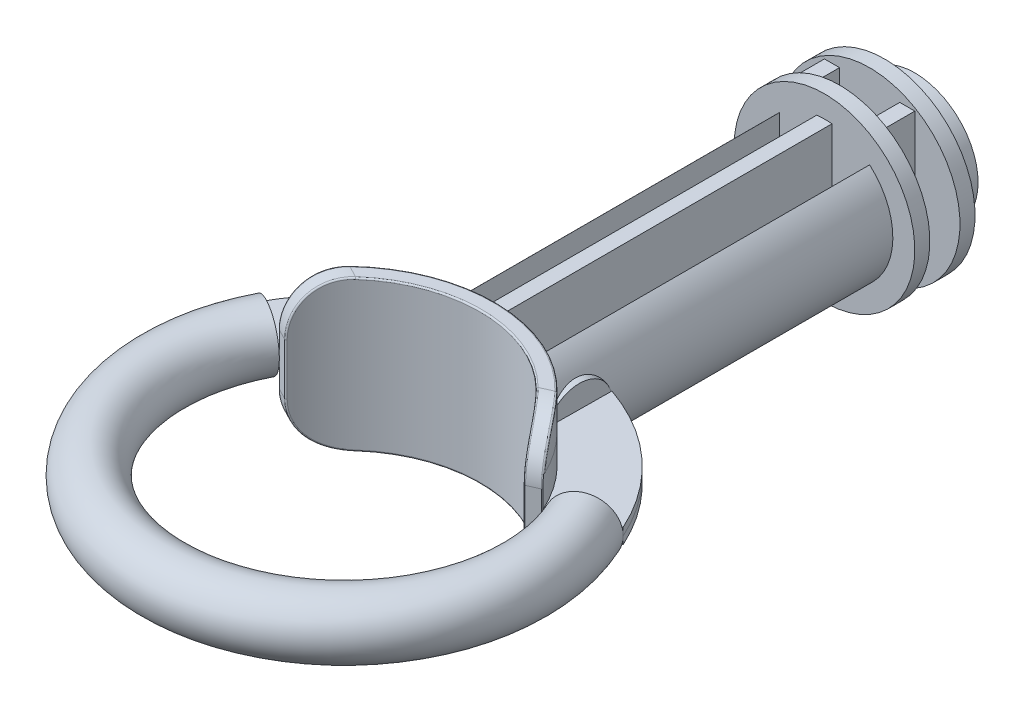
from build123d import *

# Parameters (mm, degrees)
SKETCH2_R                 = 2
BOSS_EXTRUDE1_DEPTH       = 0.88
BOSS_EXTRUDE1_DEPTH_BACK  = 22
SKETCH3_R                 = 4.542662117
BOSS_EXTRUDE10_DEPTH      = 5
BOSS_EXTRUDE10_DEPTH_BACK = 5
SKETCH7_R                 = 6
BOSS_EXTRUDE11_DEPTH      = 1
FILLET1_R                 = 3.3
FILLET2_R                 = 0.1
SKETCH9_W                 = 1.00119522
SKETCH9_H                 = 10
BOSS_EXTRUDE12_DEPTH      = 2
SKETCH10_W                = 3.99880478
SKETCH10_H                = 3.999590764
BOSS_EXTRUDE13_DEPTH      = 2
SKETCH11_R                = 6
BOSS_EXTRUDE14_DEPTH      = 1
BOSS_EXTRUDE15_DEPTH      = 1
SKETCH13_R                = 4.2
BOSS_EXTRUDE16_DEPTH      = 1
BOSS_EXTRUDE17_DEPTH      = 1
FILLET3_R                 = 7
SKETCH15_W                = 2.491765232
SKETCH15_H                = 22
SKETCH15_W_2              = 2.505572175
CUT_EXTRUDE2_DEPTH        = 4
SKETCH16_W                = 2.5
SKETCH16_H                = 22
SKETCH16_W_2              = 2.444127914
CUT_EXTRUDE3_DEPTH        = 4
CUT_EXTRUDE4_DEPTH        = 2
BOSS_EXTRUDE20_DEPTH      = 0.5
CUT_EXTRUDE5_DEPTH        = 2.5
BOSS_EXTRUDE22_DEPTH      = 0.5
CUT_EXTRUDE6_DEPTH        = 2.5
BOSS_EXTRUDE23_DEPTH      = 0.5
CUT_EXTRUDE8_START        = 2.5
CUT_EXTRUDE8_DEPTH        = 2.5
BOSS_EXTRUDE24_DEPTH      = 0.5


with BuildPart() as part:
    # Sketch2 → Revolve1 (revolve)
    with BuildSketch(Plane.XY, mode=Mode.PRIVATE) as revolve1_sk:
        with Locations((12, 0)):
            Circle(SKETCH2_R)
    revolve(revolve1_sk.sketch.rotate(Axis((0, 55, 0), (0, -1, 0)), 90), axis=Axis((0, 55, 0), (0, -1, 0)))

    # Sketch3 → Boss-Extrude1 (add, two sides: drawn at the far end of the back side and taken through both)
    with BuildSketch(Plane.XY.offset(-9.9).offset(-BOSS_EXTRUDE1_DEPTH_BACK)):
        with Locations(Location((0, 0, 0), (0, 0, 172.781900903))):
            Circle(SKETCH3_R)
    extrude(amount=BOSS_EXTRUDE1_DEPTH + BOSS_EXTRUDE1_DEPTH_BACK)

    # Sketch7 → Boss-Extrude11 (add)
    with BuildSketch(Plane(origin=(0, 0, -31.9), x_dir=(-1, 0, 0), z_dir=(0, 0, -1))):
        Circle(SKETCH7_R)
    extrude(amount=BOSS_EXTRUDE11_DEPTH)

    # Sketch9 → Boss-Extrude12 (add)
    with BuildSketch(Plane(origin=(0, 0, -32.9), x_dir=(-1, 0, 0), z_dir=(0, 0, -1))):
        with Locations((-2.5, 0)):
            Rectangle(SKETCH9_W, SKETCH9_H)
    boss_extrude12 = extrude(amount=BOSS_EXTRUDE12_DEPTH)

    # Mirror1: Boss-Extrude12 across plane
    add(boss_extrude12.mirror(Plane(origin=(0, 0, 0), x_dir=(0, 0, 1), z_dir=(1, 0, 0))))

    # Sketch10 → Boss-Extrude13 (add)
    with BuildSketch(Plane(origin=(0, 0, -32.9), x_dir=(-1, 0, 0), z_dir=(0, 0, -1))):
        Rectangle(SKETCH10_W, SKETCH10_H)
    extrude(amount=BOSS_EXTRUDE13_DEPTH)

    # Sketch11 → Boss-Extrude14 (add)
    with BuildSketch(Plane(origin=(0, 0, -34.9), x_dir=(-1, 0, 0), z_dir=(0, 0, -1))):
        Circle(SKETCH11_R)
    extrude(amount=BOSS_EXTRUDE14_DEPTH)

    # Sketch12 → Boss-Extrude15 (add)
    with BuildSketch(Plane(origin=(0, 0, -35.9), x_dir=(-1, 0, 0), z_dir=(0, 0, -1))):
        Polygon((-0.5, 0.5), (-0.5, 3), (0.5, 3), (0.5, 0.5), (3, 0.5), (3, -0.5), (0.5, -0.5), (0.5, -3), (-0.5, -3), (-0.5, -0.5), (-3, -0.5), (-3, 0.5), align=None)
    extrude(amount=BOSS_EXTRUDE15_DEPTH)

    # Sketch13 → Boss-Extrude16 (add)
    with BuildSketch(Plane(origin=(0, 0, -36.9), x_dir=(-1, 0, 0), z_dir=(0, 0, -1))):
        Circle(SKETCH13_R)
    extrude(amount=BOSS_EXTRUDE16_DEPTH)

    # Sketch14 → Boss-Extrude17 (add)
    with BuildSketch(Plane(origin=(0, 0, -37.9), x_dir=(-1, 0, 0), z_dir=(0, 0, -1))):
        Polygon((0.5, -4.170131892), (-0.5, -4.170131892), (-0.5, -0.5), (-4.170131892, -0.5), (-4.170131892, 0.5), (-0.5, 0.5), (-0.5, 4.170131892), (0.5, 4.170131892), (0.5, 0.5), (4.170131892, 0.5), (4.170131892, -0.5), (0.5, -0.5), align=None)
    extrude(amount=BOSS_EXTRUDE17_DEPTH)

    # Fillet3
    # the kernel refuses this fillet: 7 mm, written as the material it takes off along each edge
    with BuildSketch(Plane(origin=(-9.513878189, -4.170131892, -38.9), x_dir=(0, 0, 1), z_dir=(1, 0, 0)), Plane(origin=(4.170131892, -9.513878189, -38.9), x_dir=(0, 0, 1), z_dir=(0, 1, 0)), Plane(origin=(9.513878189, 4.170131892, -38.9), x_dir=(0, 0, 1), z_dir=(-1, 0, 0)), Plane(origin=(-4.170131892, 9.513878189, -38.9), x_dir=(0, 0, 1), z_dir=(0, -1, 0))) as fillet3_piece_1:
        with BuildLine():
            CenterArc((7, -3.605551275), FILLET3_R, 148.997280866, 31.002719134)
            Line((0, -3.605551275), (-0.14, -3.605551275))
            Line((-0.14, -3.605551275), (-0.14, 0))
            Line((-0.14, 0), (0, 0.14))
            ThreePointArc((0, 0.14), (0.5, 0.14), (0.88, 0.072111026))
            Line((0.88, 0.072111026), (1, 0))
        make_face()
    extrude(amount=19.027756377, mode=Mode.SUBTRACT)


with BuildPart() as body_2:
    # Sketch6 → Boss-Extrude10 (new, two sides: drawn at the far end of the back side and taken through both)
    with BuildSketch(Plane(origin=(0, 0, 0), x_dir=(1, 0, 0), z_dir=(0, 1, 0)).offset(-BOSS_EXTRUDE10_DEPTH_BACK)):
        with BuildLine():
            Line((-8.901001444, 4.557649975), (-8.022493262, 4.107820502))
            ThreePointArc((-8.022493262, 4.107820502), (0.224940881, 9.010215814), (8.217475852, 3.702388154))
            Line((8.217475852, 3.702388154), (9.117335725, 4.107820502))
            ThreePointArc((9.117335725, 4.107820502), (0.249573174, 9.996885176), (-8.901001444, 4.557649975))
        make_face()
    extrude(amount=BOSS_EXTRUDE10_DEPTH + BOSS_EXTRUDE10_DEPTH_BACK)

    # Fillet1
    fillet1_edges = [body_2.edges().sort_by_distance(p)[0] for p in [
        (-8.461747353, 5, -4.332735239),
        (8.667405789, 5, -3.905104328),
        (8.667405789, -5, -3.905104328),
        (-8.461747353, -5, -4.332735239),
    ]]
    fillet(fillet1_edges, radius=FILLET1_R)

    # Fillet2
    fillet2_edges = [body_2.edges().sort_by_distance(p)[0] for p in [
        (0.249573174, 5, -9.996885176),
        (0.224940881, 5, -9.010215814),
        (-8.901001444, 0, -4.557649975),
        (9.117335725, 0, -4.107820502),
        (0.249573174, -5, -9.996885176),
        (8.667354831, -4.053768605, -4.987680847),
        (-8.407676864, -4.053768594, -5.413960614),
        (-8.407676864, 4.053768594, -5.413960614),
        (8.667354817, 4.053768594, -4.987680851),
        (8.217475852, 0, -3.702388154),
        (-8.022493262, 0, -4.107820502),
        (0.224940881, -5, -9.010215814),
        (7.75998967, -4.05875642, -4.584446258),
        (-7.521563076, -4.058756449, -4.965951678),
        (-7.521563076, 4.058756449, -4.965951678),
        (7.75998967, 4.05875642, -4.584446258),
    ]]
    fillet(fillet2_edges, radius=FILLET2_R)


with BuildPart() as cut_extrude2_tool:
    # Sketch15 → Cut-Extrude2 (new body)
    with BuildSketch(Plane(origin=(0, 4.6, 0), x_dir=(1, 0, 0), z_dir=(0, 1, 0))):
        with Locations((-1.754117384, 20.9)):
            Rectangle(SKETCH15_W, SKETCH15_H)
        with Locations((1.747213912, 20.9)):
            Rectangle(SKETCH15_W_2, SKETCH15_H)
    extrude(amount=-CUT_EXTRUDE2_DEPTH)


with BuildPart() as part_1:
    add(part.part)

    # Cut-Extrude2: cut by cut_extrude2_tool
    add(cut_extrude2_tool.part, mode=Mode.SUBTRACT)


with BuildPart() as body_2_1:
    add(body_2.part)

    # Cut-Extrude2: cut by cut_extrude2_tool
    add(cut_extrude2_tool.part, mode=Mode.SUBTRACT)


with BuildPart() as cut_extrude3_tool:
    # Sketch16 → Cut-Extrude3 (new body)
    with BuildSketch(Plane(origin=(0, -4.5, 0), x_dir=(1, 0, 0), z_dir=(0, 1, 0))):
        with Locations((1.707075343, 20.897464392)):
            Rectangle(SKETCH16_W, SKETCH16_H)
        with Locations((-1.8208607, 20.897464392)):
            Rectangle(SKETCH16_W_2, SKETCH16_H)
    extrude(amount=CUT_EXTRUDE3_DEPTH)


with BuildPart() as part_2:
    add(part_1.part)

    # Cut-Extrude3: cut by cut_extrude3_tool
    add(cut_extrude3_tool.part, mode=Mode.SUBTRACT)


with BuildPart() as body_2_2:
    add(body_2_1.part)

    # Cut-Extrude3: cut by cut_extrude3_tool
    add(cut_extrude3_tool.part, mode=Mode.SUBTRACT)


with BuildPart() as cut_extrude4_tool:
    # Sketch17 → Cut-Extrude4 (new body)
    with BuildSketch(Plane(origin=(0, 0, 0), x_dir=(1, 0, 0), z_dir=(0, 1, 0))):
        with BuildLine():
            Line((-8.860703893, 4.568842081), (-12.443220527, 6.416094055))
            ThreePointArc((-12.443220527, 6.416094055), (-9.164357143, 10.58369303), (-4.570697172, 13.232865425))
            Line((-4.570697172, 13.232865425), (-4.570697172, 8.876653422))
            ThreePointArc((-4.570697172, 8.876653422), (-7.066682392, 7.072278968), (-8.860703893, 4.568842081))
        make_face()
    extrude(amount=-CUT_EXTRUDE4_DEPTH)


with BuildPart() as part_3:
    add(part_2.part)

    # Cut-Extrude4: cut by cut_extrude4_tool
    add(cut_extrude4_tool.part, mode=Mode.SUBTRACT)


with BuildPart() as body_2_3:
    add(body_2_2.part)

    # Cut-Extrude4: cut by cut_extrude4_tool
    add(cut_extrude4_tool.part, mode=Mode.SUBTRACT)


with BuildPart() as body_3:
    # Sketch17<2> → Boss-Extrude20 (new body)
    with BuildSketch(Plane(origin=(0, 0, 0), x_dir=(1, 0, 0), z_dir=(0, 1, 0))):
        with BuildLine():
            Line((-8.860703893, 4.568842081), (-12.443220527, 6.416094055))
            ThreePointArc((-12.443220527, 6.416094055), (-9.164357143, 10.58369303), (-4.570697172, 13.232865425))
            Line((-4.570697172, 13.232865425), (-4.570697172, 8.876653422))
            ThreePointArc((-4.570697172, 8.876653422), (-7.066682392, 7.072278968), (-8.860703893, 4.568842081))
        make_face()
    extrude(amount=-BOSS_EXTRUDE20_DEPTH)


with BuildPart() as cut_extrude5_tool:
    # Sketch17<3> → Cut-Extrude5 (new body)
    with BuildSketch(Plane(origin=(0, 0, 0), x_dir=(1, 0, 0), z_dir=(0, 1, 0))):
        with BuildLine():
            Line((-8.860703893, 4.568842081), (-12.443220527, 6.416094055))
            ThreePointArc((-12.443220527, 6.416094055), (-9.164357143, 10.58369303), (-4.570697172, 13.232865425))
            Line((-4.570697172, 13.232865425), (-4.570697172, 8.876653422))
            ThreePointArc((-4.570697172, 8.876653422), (-7.066682392, 7.072278968), (-8.860703893, 4.568842081))
        make_face()
    extrude(amount=CUT_EXTRUDE5_DEPTH)


with BuildPart() as part_4:
    add(part_3.part)

    # Cut-Extrude5: cut by cut_extrude5_tool
    add(cut_extrude5_tool.part, mode=Mode.SUBTRACT)


with BuildPart() as body_2_4:
    add(body_2_3.part)

    # Cut-Extrude5: cut by cut_extrude5_tool
    add(cut_extrude5_tool.part, mode=Mode.SUBTRACT)


with BuildPart() as body_4:
    # Sketch17<4> → Boss-Extrude22 (new body)
    with BuildSketch(Plane(origin=(0, 0, 0), x_dir=(1, 0, 0), z_dir=(0, 1, 0))):
        with BuildLine():
            Line((-8.860703893, 4.568842081), (-12.443220527, 6.416094055))
            ThreePointArc((-12.443220527, 6.416094055), (-9.164357143, 10.58369303), (-4.570697172, 13.232865425))
            Line((-4.570697172, 13.232865425), (-4.570697172, 8.876653422))
            ThreePointArc((-4.570697172, 8.876653422), (-7.066682392, 7.072278968), (-8.860703893, 4.568842081))
        make_face()
    extrude(amount=BOSS_EXTRUDE22_DEPTH)


with BuildPart() as cut_extrude6_tool:
    # Sketch18 → Cut-Extrude6 (new body)
    with BuildSketch(Plane(origin=(0, 0, 0), x_dir=(1, 0, 0), z_dir=(0, 1, 0))):
        with BuildLine():
            Line((9.078317368, 4.122758322), (12.747113282, 5.788877524))
            ThreePointArc((12.747113282, 5.788877524), (9.413992972, 10.362274669), (4.542662117, 13.242515656))
            Line((4.542662117, 13.242515656), (4.506661794, 9.02))
            ThreePointArc((4.506661794, 9.02), (7.194001254, 6.946196905), (9.078317368, 4.122758322))
        make_face()
    extrude(amount=-CUT_EXTRUDE6_DEPTH)


with BuildPart() as part_5:
    add(part_4.part)

    # Cut-Extrude6: cut by cut_extrude6_tool
    add(cut_extrude6_tool.part, mode=Mode.SUBTRACT)


with BuildPart() as body_2_5:
    add(body_2_4.part)

    # Cut-Extrude6: cut by cut_extrude6_tool
    add(cut_extrude6_tool.part, mode=Mode.SUBTRACT)


with BuildPart() as body_5:
    # Sketch18<2> → Boss-Extrude23 (new body)
    with BuildSketch(Plane(origin=(0, 0, 0), x_dir=(1, 0, 0), z_dir=(0, 1, 0))):
        with BuildLine():
            Line((9.078317368, 4.122758322), (12.747113282, 5.788877524))
            ThreePointArc((12.747113282, 5.788877524), (9.413992972, 10.362274669), (4.542662117, 13.242515656))
            Line((4.542662117, 13.242515656), (4.506661794, 9.02))
            ThreePointArc((4.506661794, 9.02), (7.194001254, 6.946196905), (9.078317368, 4.122758322))
        make_face()
    extrude(amount=-BOSS_EXTRUDE23_DEPTH)


with BuildPart() as cut_extrude8_tool:
    # Sketch18<4> → Cut-Extrude8 (new body)
    with BuildSketch(Plane(origin=(0, 0, 0), x_dir=(1, 0, 0), z_dir=(0, 1, 0)).offset(CUT_EXTRUDE8_START)):
        with BuildLine():
            Line((9.078317368, 4.122758322), (12.747113282, 5.788877524))
            ThreePointArc((12.747113282, 5.788877524), (9.413992972, 10.362274669), (4.542662117, 13.242515656))
            Line((4.542662117, 13.242515656), (4.506661794, 9.02))
            ThreePointArc((4.506661794, 9.02), (7.194001254, 6.946196905), (9.078317368, 4.122758322))
        make_face()
    extrude(amount=-CUT_EXTRUDE8_DEPTH)


with BuildPart() as part_6:
    add(part_5.part)

    # Cut-Extrude8: cut by cut_extrude8_tool
    add(cut_extrude8_tool.part, mode=Mode.SUBTRACT)


with BuildPart() as body_2_6:
    add(body_2_5.part)

    # Cut-Extrude8: cut by cut_extrude8_tool
    add(cut_extrude8_tool.part, mode=Mode.SUBTRACT)


with BuildPart() as body_6:
    # Sketch18<5> → Boss-Extrude24 (new body)
    with BuildSketch(Plane(origin=(0, 0, 0), x_dir=(1, 0, 0), z_dir=(0, 1, 0))):
        with BuildLine():
            Line((9.078317368, 4.122758322), (12.747113282, 5.788877524))
            ThreePointArc((12.747113282, 5.788877524), (9.413992972, 10.362274669), (4.542662117, 13.242515656))
            Line((4.542662117, 13.242515656), (4.506661794, 9.02))
            ThreePointArc((4.506661794, 9.02), (7.194001254, 6.946196905), (9.078317368, 4.122758322))
        make_face()
    extrude(amount=BOSS_EXTRUDE24_DEPTH)


solid = Compound([body_3.part, body_4.part, body_5.part, part_6.part, body_2_6.part, body_6.part])
